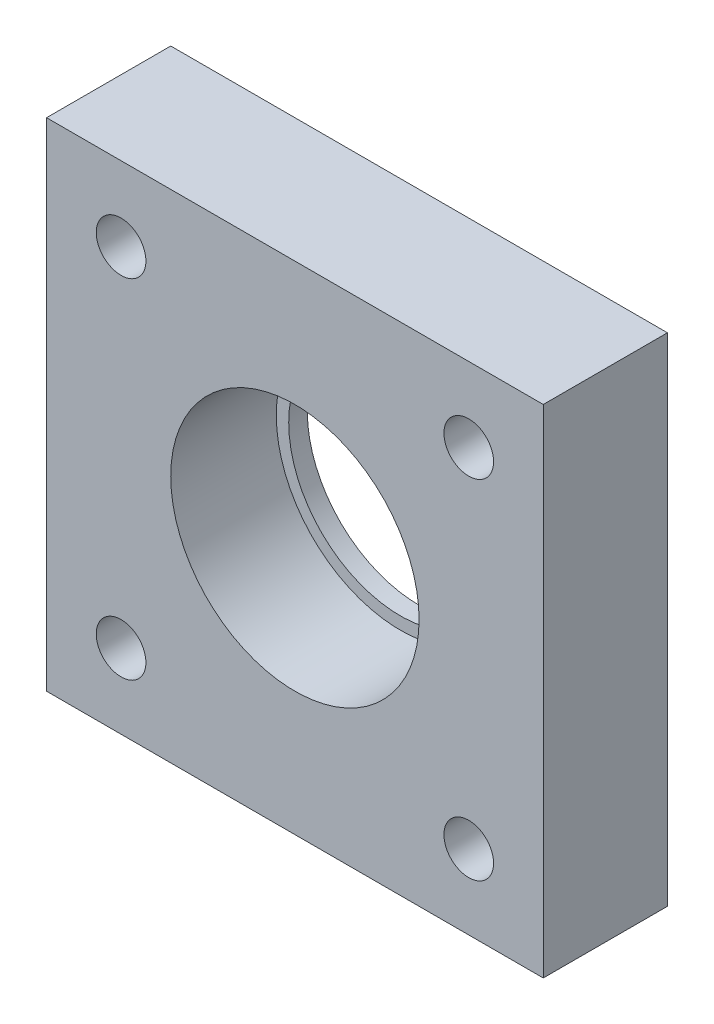
from build123d import *

# Parameters (mm, degrees)
SKETCH1_W           = 40
SKETCH1_H           = 40
SKETCH1_R           = 2
SKETCH1_R_2         = 10
BOSS_EXTRUDE1_DEPTH = 10
SKETCH2_R           = 10
SKETCH2_R_2         = 9
BOSS_EXTRUDE2_DEPTH = 1.5


with BuildPart() as part:
    # Sketch1 → Boss-Extrude1 (new body)
    with BuildSketch(Plane.XY):
        Rectangle(SKETCH1_W, SKETCH1_H)
        with Locations((-14, -14)):
            Circle(SKETCH1_R, mode=Mode.SUBTRACT)
        with Locations((14, -14)):
            Circle(SKETCH1_R, mode=Mode.SUBTRACT)
        Circle(SKETCH1_R_2, mode=Mode.SUBTRACT)
        with Locations((-14, 14)):
            Circle(SKETCH1_R, mode=Mode.SUBTRACT)
        with Locations((14, 14)):
            Circle(SKETCH1_R, mode=Mode.SUBTRACT)
    extrude(amount=BOSS_EXTRUDE1_DEPTH)

    # Sketch2 → Boss-Extrude2 (add)
    with BuildSketch(Plane(origin=(0, 0, 0), x_dir=(-1, 0, 0), z_dir=(0, 0, -1))):
        Circle(SKETCH2_R)
        Circle(SKETCH2_R_2, mode=Mode.SUBTRACT)
    extrude(amount=-BOSS_EXTRUDE2_DEPTH)


solid = part.part
